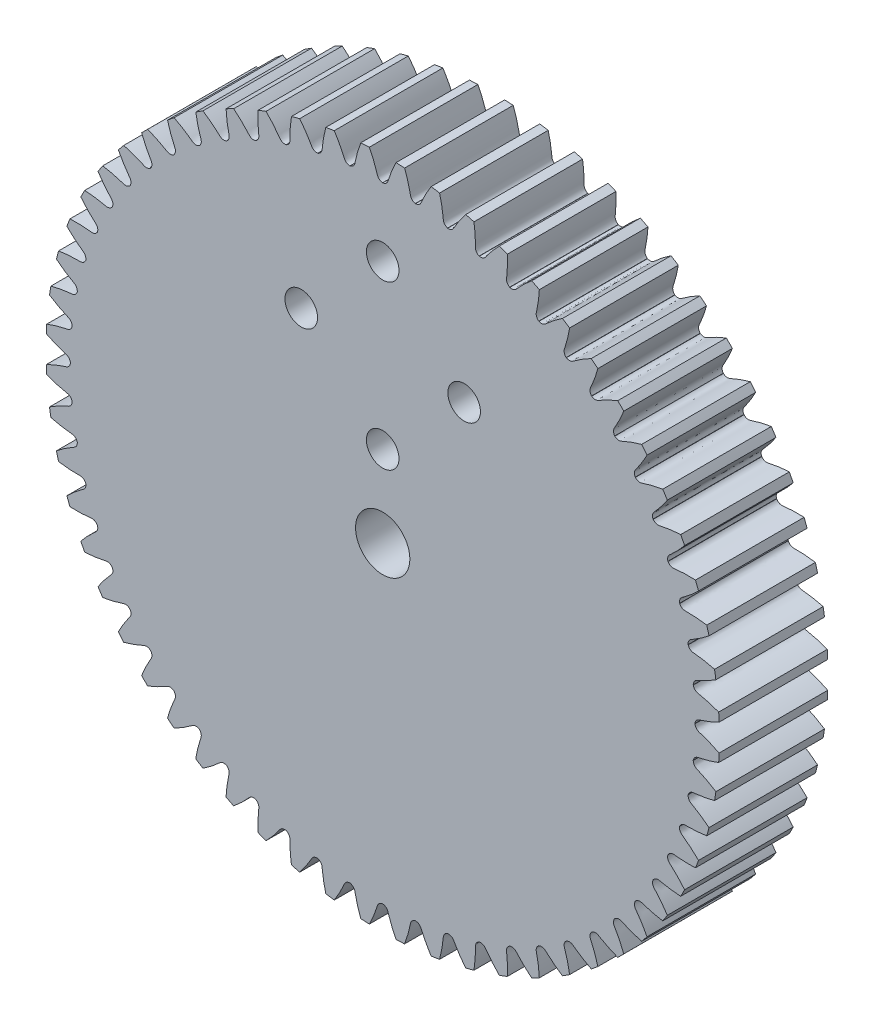
from build123d import *

# Parameters (mm, degrees)
SKETCH_1_R               = 31
EXTRUDE_1_DEPTH          = 10
CUT_EXTRUDE_1_DEPTH      = 45.966654312
PATTERN_CIRCULAR_1_COUNT = 60
SKETCH_4_R               = 1.5
CUT_EXTRUDE_2_DEPTH      = 10
SKETCH_5_R               = 2.5
CUT_EXTRUDE_3_DEPTH      = 10


with BuildPart() as part:
    # 草图1 → 凸台-拉伸1 (new body)
    with BuildSketch(Plane.XY):
        Circle(SKETCH_1_R)
    extrude(amount=EXTRUDE_1_DEPTH)

    # 草图2 → 切除-拉伸1 (cut, through all)
    with BuildSketch(Plane.XY):
        with BuildLine():
            ThreePointArc((0.01, 28.749955146), (0, 28.749956885), (-0.01, 28.749955146))
            add(Edge.make_bspline(
                [(-0.01, 28.749955146), (-0.429486861, 28.819346682), (-0.495837594, 29.165510951), (-0.623870472, 29.550234202), (-0.684032437, 29.723155344), (-0.751857968, 29.905235087), (-0.827366852, 30.09646236), (-0.911058345, 30.296531075), (-1.003283142, 30.505205894), (-1.104426215, 30.722215721), (-1.214853301, 30.947284868), (-1.334925974, 31.18012428), (-1.464996911, 31.420434309), (-1.605410859, 31.667904179), (-1.756503978, 31.922212404), (-1.918603646, 32.183026949), (-2.092028155, 32.450005472), (-2.277086427, 32.722795549), (-2.474077745, 33.001034914), (-2.683291482, 33.284351708), (-2.905006832, 33.57236473), (-3.139492582, 33.864683697), (-3.387006745, 34.160909512), (-3.739661599, 34.566214433), (-4.017144851, 34.866196888), (-4.208552041, 35.065218488)],
                knots=[0, 0, 0, 0, 0.112555337, 0.134959594, 0.158834787, 0.184180916, 0.210997981, 0.239285981, 0.269044917, 0.300274789, 0.332975596, 0.367147339, 0.402790018, 0.439903633, 0.478488184, 0.51854367, 0.560070092, 0.60306745, 0.647535744, 0.693474973, 0.740885138, 0.789766239, 0.840118276, 0.891941248, 1, 1, 1, 1], degree=3))
            ThreePointArc((-4.208552041, 35.065218488), (0, 35.316872142), (4.208552041, 35.065218488))
            add(Edge.make_bspline(
                [(0.01, 28.749955146), (0.429486861, 28.819346682), (0.495837594, 29.165510951), (0.623870472, 29.550234202), (0.684032437, 29.723155344), (0.751857968, 29.905235087), (0.827366852, 30.09646236), (0.911058345, 30.296531075), (1.003283142, 30.505205894), (1.104426215, 30.722215721), (1.214853301, 30.947284868), (1.334925974, 31.18012428), (1.464996911, 31.420434309), (1.605410859, 31.667904179), (1.756503978, 31.922212404), (1.918603646, 32.183026949), (2.092028155, 32.450005472), (2.277086427, 32.722795549), (2.474077745, 33.001034914), (2.683291482, 33.284351708), (2.905006832, 33.57236473), (3.139492582, 33.864683697), (3.387006745, 34.160909512), (3.739661599, 34.566214433), (4.017144851, 34.866196888), (4.208552041, 35.065218488)],
                knots=[0, 0, 0, 0, 0.112555337, 0.134959594, 0.158834787, 0.184180916, 0.210997981, 0.239285981, 0.269044917, 0.300274789, 0.332975596, 0.367147339, 0.402790018, 0.439903633, 0.478488184, 0.51854367, 0.560070092, 0.60306745, 0.647535744, 0.693474973, 0.740885138, 0.789766239, 0.840118276, 0.891941248, 1, 1, 1, 1], degree=3))
        make_face()
    cut_extrude_1 = extrude(amount=CUT_EXTRUDE_1_DEPTH, mode=Mode.SUBTRACT)

    # 阵列(圆周)1: 切除-拉伸1 ×60 about axis
    pattern_circular_1_axis = Axis((0, 0, -0.5), (0, 0, 1))
    for i in range(1, PATTERN_CIRCULAR_1_COUNT):
        add(cut_extrude_1.rotate(pattern_circular_1_axis, i * 360 / PATTERN_CIRCULAR_1_COUNT), mode=Mode.SUBTRACT)

    # 草图4 → 切除-拉伸2 (cut)
    with BuildSketch(Plane.XY.offset(10)):
        with Locations((0, 22.5)):
            Circle(SKETCH_4_R)
        with Locations((7.5, 15)):
            Circle(SKETCH_4_R)
        with Locations((0, 7.5)):
            Circle(SKETCH_4_R)
        with Locations((-7.5, 15)):
            Circle(SKETCH_4_R)
    extrude(amount=-CUT_EXTRUDE_2_DEPTH, mode=Mode.SUBTRACT)

    # 草图5 → 切除-拉伸3 (cut)
    with BuildSketch(Plane.XY.offset(10)):
        Circle(SKETCH_5_R)
    extrude(amount=-CUT_EXTRUDE_3_DEPTH, mode=Mode.SUBTRACT)


solid = part.part
